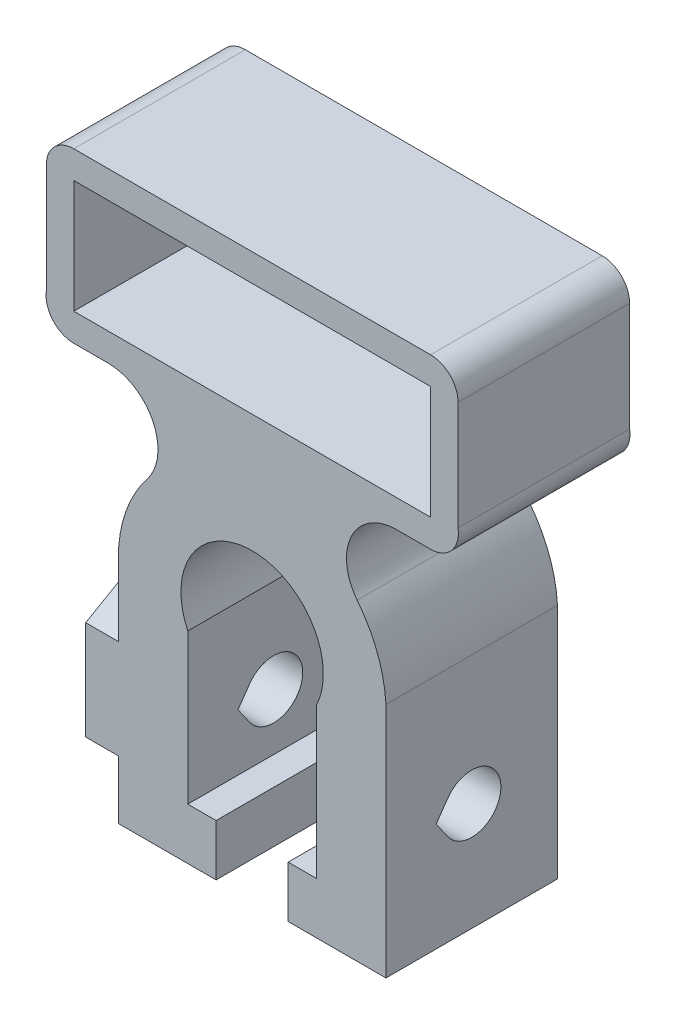
from build123d import *

# Parameters (mm, degrees)
BOSS_EXTRUDE1_DEPTH   = 10
CUT_EXTRUDE6_DEPTH    = 29.232073959
BOSS_EXTRUDE4_DEPTH   = 1.9
CUT_EXTRUDE7_DEPTH    = 1.1
BOSS_EXTRUDE5_START   = -10
SKETCH31_W            = 6.6
SKETCH31_H            = 20.8
BOSS_EXTRUDE5_DEPTH   = 10
SKETCH32_W            = 1.175
SKETCH32_H            = 20.8
SKETCH32_W_2          = 1.425
BOSS_EXTRUDE6_DEPTH   = 1.2
SKETCH33_W            = 3
SKETCH33_H            = 10
BOSS_EXTRUDE7_DEPTH   = 1.65
SKETCH34_W            = 3
SKETCH34_H            = 10
BOSS_EXTRUDE8_DEPTH   = 1.65
BODY_MOVE_COPY1_ANGLE = 180


with BuildPart() as part:
    # Sketch1 → Boss-Extrude1 (new body)
    with BuildSketch(Plane.XY):
        with BuildLine():
            Line((7.490021902, 0), (21.300000001, 0))
            Line((21.300000001, 0), (21.300000001, 4.05))
            Line((21.300000001, 4.05), (9.555596341, 4.05))
            ThreePointArc((9.555596341, 4.05), (3.627957458, 7.8), (9.555596341, 11.55))
            Line((9.555596341, 11.55), (21.300000001, 11.55))
            Line((21.300000001, 11.55), (21.300000001, 15.6))
            Line((21.300000001, 15.6), (7.911262801, 15.6))
            ThreePointArc((7.911262801, 15.6), (0.108419667, 8.005009917), (7.490021902, 0))
        make_face()
    extrude(amount=-BOSS_EXTRUDE1_DEPTH)

    # Sketch19 → Cut-Extrude6 (cut, through all)
    with BuildSketch(Plane.XZ):
        with BuildLine():
            Line((15.975079943, -6.392558475), (15.000000001, -7.075316801))
            Line((15.000000001, -7.075316801), (14.024920059, -6.392558475))
            ThreePointArc((14.024920059, -6.392558475), (15.000000001, -3.3), (15.975079943, -6.392558475))
        make_face()
    extrude(amount=-CUT_EXTRUDE6_DEPTH, mode=Mode.SUBTRACT)

    # Sketch21 → Boss-Extrude4 (add)
    with BuildSketch(Plane(origin=(0, 15.6, 0), x_dir=(1, 0, 0), z_dir=(0, 1, 0))):
        Polygon((20.773502693, 5), (17.886751347, 10), (12.113248655, 10), (9.226497309, 5), (12.113248655, 0), (17.886751347, 0), align=None)
        Polygon((13.267949194, 8), (11.535898386, 5), (13.267949194, 2), (16.732050809, 2), (18.464101616, 5), (16.732050809, 8), align=None, mode=Mode.SUBTRACT)
    extrude(amount=BOSS_EXTRUDE4_DEPTH)

    # Sketch22 → Cut-Extrude7 (cut)
    with BuildSketch(Plane(origin=(0, 15.6, 0), x_dir=(1, 0, 0), z_dir=(0, 1, 0))):
        Polygon((16.732050809, 8), (13.267949194, 8), (11.535898386, 5), (13.267949194, 2), (16.732050809, 2), (18.464101616, 5), align=None)
    extrude(amount=-CUT_EXTRUDE7_DEPTH, mode=Mode.SUBTRACT)

    # Sketch31 → Boss-Extrude5 (add)
    with BuildSketch(Plane(origin=(0, 0, -10), x_dir=(-1, 0, 0), z_dir=(0, 0, -1)).offset(BOSS_EXTRUDE5_START)):
        with BuildLine():
            Line((1.642634889, 18.194312696), (1.642634889, 16.194312696))
            ThreePointArc((1.642634889, 16.194312696), (0.002167009, 13.578091054), (-3.067375979, 13.915220696))
            ThreePointArc((-3.067375979, 13.915220696), (-0.105575497, 7.794312696), (-3.067375979, 1.673404696))
            ThreePointArc((-3.067375979, 1.673404696), (0.002167009, 2.010534337), (1.642634889, -0.605687304))
            Line((1.642634889, -0.605687304), (1.642634889, -2.608681933))
            ThreePointArc((1.642634889, -2.608681933), (2.210176801, -3.836976077), (3.512045594, -4.205687304))
            Line((3.512045594, -4.205687304), (9.862045594, -4.205687304))
            ThreePointArc((9.862045594, -4.205687304), (10.993416444, -3.737058154), (11.462045594, -2.605687304))
            Line((11.462045594, -2.605687304), (11.462045594, 18.194312696))
            ThreePointArc((11.462045594, 18.194312696), (10.993416444, 19.325683546), (9.862045594, 19.794312696))
            Line((9.862045594, 19.794312696), (3.512027658, 19.794312696))
            ThreePointArc((3.512027658, 19.794312696), (2.209033865, 19.424620515), (1.642634889, 18.194312696))
        make_face()
        with Locations((6.562045594, 7.794312696)):
            Rectangle(SKETCH31_W, SKETCH31_H, mode=Mode.SUBTRACT)
    extrude(amount=BOSS_EXTRUDE5_DEPTH)

    # Sketch32 → Boss-Extrude6 (add)
    with BuildSketch(Plane.XY):
        with Locations((-3.849545594, 7.794312696)):
            Rectangle(SKETCH32_W, SKETCH32_H)
        with Locations((-9.149545594, 7.794312696)):
            Rectangle(SKETCH32_W_2, SKETCH32_H)
    extrude(amount=-BOSS_EXTRUDE6_DEPTH)

    # Sketch33 → Boss-Extrude7 (add)
    with BuildSketch(Plane.XZ.offset(-11.55)):
        with Locations((19.800000001, -5)):
            Rectangle(SKETCH33_W, SKETCH33_H)
    extrude(amount=BOSS_EXTRUDE7_DEPTH)

    # Sketch34 → Boss-Extrude8 (add)
    with BuildSketch(Plane(origin=(0, 4.05, 0), x_dir=(1, 0, 0), z_dir=(0, 1, 0))):
        with Locations((19.800000001, 5)):
            Rectangle(SKETCH34_W, SKETCH34_H)
    extrude(amount=BOSS_EXTRUDE8_DEPTH)


with BuildPart() as part_1:
    # Body-Move/Copy1: read off the stored shape, not the designer's step
    # Body-Move/Copy1: moved
    add(part.part.moved(Location((-21.9272776, -16.282285, 0))).rotate(Axis((0, 0, 0), (0.7071067812, -0.7071067812, 0)), BODY_MOVE_COPY1_ANGLE))


solid = part_1.part
